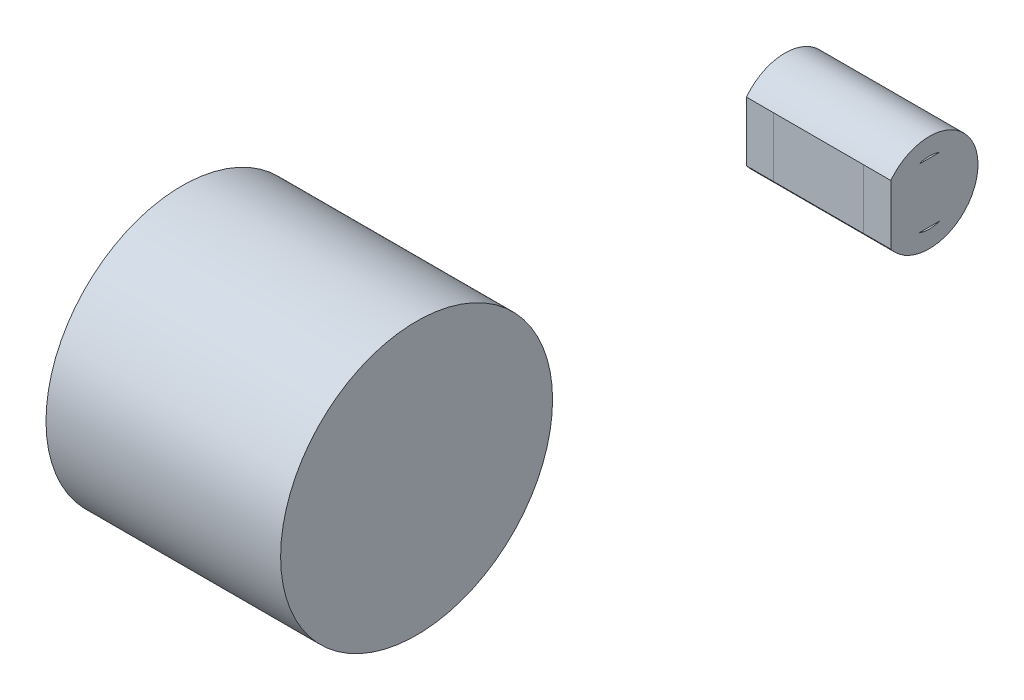
from build123d import *
from build123d.topology import SkipClean

# Parameters (mm, degrees)
SKETCH1_R            = 62.811183182
SKETCH1_R_2          = 3.25
SKETCH1_R_3          = 36.5175
BOSS_EXTRUDE1_DEPTH  = 10
BOSS_EXTRUDE2_START  = -100
SKETCH1_3_R          = 62.811183182
BOSS_EXTRUDE2_DEPTH  = 100
BOSS_EXTRUDE3_DEPTH  = 100
SKETCH2_4_R          = 3.25
SKETCH2_4_R_2        = 36.5175
BOSS_EXTRUDE4_DEPTH  = 10
BOSS_EXTRUDE5_DEPTH  = 100
SKETCH4_R            = 75.344599786
BOSS_EXTRUDE6_DEPTH  = 20
SKETCH5_R            = 7.5
BOSS_EXTRUDE7_DEPTH  = 11
SKETCH5_3_R          = 17.5
SKETCH5_3_R_2        = 7.5
BOSS_EXTRUDE8_DEPTH  = 50
SKETCH6_R            = 7.5
BOSS_EXTRUDE9_DEPTH  = 11
BOSS_EXTRUDE10_DEPTH = 50
BOSS_EXTRUDE11_DEPTH = 15
BOSS_EXTRUDE12_DEPTH = 50
BOSS_EXTRUDE13_DEPTH = 15


# Read off the part's stored shape, not the designer's step: Boss-Extrude11
with BuildPart() as part:
    # Sketch1 → Boss-Extrude1 (new body)
    # profile 1 of 2: a face of its own
    with BuildSketch(Plane(origin=(0, 0, 0), x_dir=(0, 0, -1), z_dir=(1, 0, 0))):
        Circle(SKETCH1_R)
        with BuildLine():
            ThreePointArc((43, 34.9), (40.627564928, 40.627564928), (34.9, 43))
            Line((34.9, 43), (-34.9, 43))
            ThreePointArc((-34.9, 43), (-40.627564928, 40.627564928), (-43, 34.9))
            Line((-43, 34.9), (-43, -34.9))
            ThreePointArc((-43, -34.9), (-40.627564928, -40.627564928), (-34.9, -43))
            Line((-34.9, -43), (34.9, -43))
            ThreePointArc((34.9, -43), (40.627564928, -40.627564928), (43, -34.9))
            Line((43, -34.9), (43, 34.9))
        make_face(mode=Mode.SUBTRACT)
    # profile 2 of 2: a face of its own
    with BuildSketch(Plane(origin=(0, 0, 0), x_dir=(0, 0, -1), z_dir=(1, 0, 0))):
        with BuildLine():
            Line((43, -34.9), (43, 34.9))
            ThreePointArc((43, 34.9), (40.627564928, 40.627564928), (34.9, 43))
            Line((34.9, 43), (-34.9, 43))
            ThreePointArc((-34.9, 43), (-40.627564928, 40.627564928), (-43, 34.9))
            Line((-43, 34.9), (-43, -34.9))
            ThreePointArc((-43, -34.9), (-40.627564928, -40.627564928), (-34.9, -43))
            Line((-34.9, -43), (34.9, -43))
            ThreePointArc((34.9, -43), (40.627564928, -40.627564928), (43, -34.9))
        make_face()
        with Locations((-34.9, -34.9)):
            Circle(SKETCH1_R_2, mode=Mode.SUBTRACT)
        with Locations((34.9, -34.9)):
            Circle(SKETCH1_R_2, mode=Mode.SUBTRACT)
        with Locations((34.9, 34.9)):
            Circle(SKETCH1_R_2, mode=Mode.SUBTRACT)
        with Locations((-34.9, 34.9)):
            Circle(SKETCH1_R_2, mode=Mode.SUBTRACT)
        Circle(SKETCH1_R_3, mode=Mode.SUBTRACT)
    extrude(amount=BOSS_EXTRUDE1_DEPTH)

    # Sketch1<3> → Boss-Extrude2 (add)
    with BuildSketch(Plane(origin=(0, 0, 0), x_dir=(0, 0, -1), z_dir=(1, 0, 0)).offset(BOSS_EXTRUDE2_START)):
        Circle(SKETCH1_3_R)
        with BuildLine():
            ThreePointArc((43, 34.9), (40.627564928, 40.627564928), (34.9, 43))
            Line((34.9, 43), (-34.9, 43))
            ThreePointArc((-34.9, 43), (-40.627564928, 40.627564928), (-43, 34.9))
            Line((-43, 34.9), (-43, -34.9))
            ThreePointArc((-43, -34.9), (-40.627564928, -40.627564928), (-34.9, -43))
            Line((-34.9, -43), (34.9, -43))
            ThreePointArc((34.9, -43), (40.627564928, -40.627564928), (43, -34.9))
            Line((43, -34.9), (43, 34.9))
        make_face(mode=Mode.SUBTRACT)
    extrude(amount=BOSS_EXTRUDE2_DEPTH)


with BuildPart() as body_2:
    # Sketch2 → Boss-Extrude3 (new body)
    with BuildSketch(Plane(origin=(10, 0, 0), x_dir=(0, 0, -1), z_dir=(1, 0, 0))):
        with BuildLine():
            Line((44, 36.5175), (44, -36.5175))
            Line((44, -36.5175), (65.903572821, -36.5175))
            ThreePointArc((65.903572821, -36.5175), (75.344599786, 0), (65.903572821, 36.5175))
            Line((65.903572821, 36.5175), (44, 36.5175))
        make_face()
    extrude(amount=-BOSS_EXTRUDE3_DEPTH)


with BuildPart() as body_3:
    # Sketch2<4> → Boss-Extrude4 (new body)
    # profile 1 of 9: a face of its own
    with BuildSketch(Plane(origin=(10, 0, 0), x_dir=(0, 0, -1), z_dir=(1, 0, 0))):
        with BuildLine():
            Line((44, -36.5175), (44, 36.5175))
            Line((44, 36.5175), (51.104959901, 36.5175))
            ThreePointArc((51.104959901, 36.5175), (-62.811183182, 0), (51.104959901, -36.5175))
            Line((51.104959901, -36.5175), (44, -36.5175))
        make_face()
        with Locations((-34.9, -34.9)):
            Circle(SKETCH2_4_R, mode=Mode.SUBTRACT)
        with Locations((34.9, -34.9)):
            Circle(SKETCH2_4_R, mode=Mode.SUBTRACT)
        Circle(SKETCH2_4_R_2, mode=Mode.SUBTRACT)
        with Locations((-34.9, 34.9)):
            Circle(SKETCH2_4_R, mode=Mode.SUBTRACT)
        with Locations((34.9, 34.9)):
            Circle(SKETCH2_4_R, mode=Mode.SUBTRACT)
    # profile 2 of 9: a face of its own
    with BuildSketch(Plane(origin=(10, 0, 0), x_dir=(0, 0, -1), z_dir=(1, 0, 0))):
        with Locations((34.9, 34.9)):
            Circle(SKETCH2_4_R)
    # profile 3 of 9: a face of its own
    with BuildSketch(Plane(origin=(10, 0, 0), x_dir=(0, 0, -1), z_dir=(1, 0, 0))):
        with Locations((34.9, -34.9)):
            Circle(SKETCH2_4_R)
    # profile 4 of 9: a face of its own
    with BuildSketch(Plane(origin=(10, 0, 0), x_dir=(0, 0, -1), z_dir=(1, 0, 0))):
        with Locations((-34.9, -34.9)):
            Circle(SKETCH2_4_R)
    # profile 5 of 9: a face of its own
    with BuildSketch(Plane(origin=(10, 0, 0), x_dir=(0, 0, -1), z_dir=(1, 0, 0))):
        with Locations((-34.9, 34.9)):
            Circle(SKETCH2_4_R)
    # profile 6 of 9: a face of its own
    with BuildSketch(Plane(origin=(10, 0, 0), x_dir=(0, 0, -1), z_dir=(1, 0, 0))):
        Circle(SKETCH2_4_R_2)
    # profile 7 of 9: a face of its own
    with BuildSketch(Plane(origin=(10, 0, 0), x_dir=(0, 0, -1), z_dir=(1, 0, 0))):
        with BuildLine():
            Line((51.104959901, 36.5175), (44, 36.5175))
            Line((44, 36.5175), (44, -36.5175))
            Line((44, -36.5175), (51.104959901, -36.5175))
            ThreePointArc((51.104959901, -36.5175), (59.813074367, -19.173963269), (62.811183182, 0))
            ThreePointArc((62.811183182, 0), (59.813074367, 19.173963269), (51.104959901, 36.5175))
        make_face()
    # profile 8 of 9: a face of its own
    with BuildSketch(Plane(origin=(10, 0, 0), x_dir=(0, 0, -1), z_dir=(1, 0, 0))):
        with BuildLine():
            Line((65.903572821, 36.5175), (51.104959901, 36.5175))
            ThreePointArc((51.104959901, 36.5175), (59.813074367, 19.173963269), (62.811183182, 0))
            ThreePointArc((62.811183182, 0), (59.813074367, -19.173963269), (51.104959901, -36.5175))
            Line((51.104959901, -36.5175), (65.903572821, -36.5175))
            ThreePointArc((65.903572821, -36.5175), (75.344599786, 0), (65.903572821, 36.5175))
        make_face()
    # profile 9 of 9: a face of its own
    with BuildSketch(Plane(origin=(10, 0, 0), x_dir=(0, 0, -1), z_dir=(1, 0, 0))):
        with BuildLine():
            ThreePointArc((51.104959901, -36.5175), (-62.811183182, 0), (51.104959901, 36.5175))
            Line((51.104959901, 36.5175), (65.903572821, 36.5175))
            ThreePointArc((65.903572821, 36.5175), (-75.344599786, 0), (65.903572821, -36.5175))
            Line((65.903572821, -36.5175), (51.104959901, -36.5175))
        make_face()
    extrude(amount=BOSS_EXTRUDE4_DEPTH)

    # Sketch3 → Boss-Extrude5 (add)
    with BuildSketch(Plane.ZY.offset(-10)):
        with BuildLine():
            ThreePointArc((-65.903572821, -36.5175), (75.344599786, 0), (-65.903572821, 36.5175))
            Line((-65.903572821, 36.5175), (-44, 36.5175))
            Line((-44, 36.5175), (-44, -36.5175))
            Line((-44, -36.5175), (-65.903572821, -36.5175))
        make_face()
    extrude(amount=BOSS_EXTRUDE5_DEPTH)

    # Sketch4 → Boss-Extrude6 (add)
    with SkipClean():  # the faces are left unmerged after this step: merging them gives an invalid solid
        with BuildSketch(Plane.ZY.offset(90)):
            Circle(SKETCH4_R)
        extrude(amount=BOSS_EXTRUDE6_DEPTH)


with BuildPart() as body_4:
    # Sketch5 → Boss-Extrude7 (new body)
    with BuildSketch(Plane(origin=(10, 0, 0), x_dir=(0, 0, -1), z_dir=(1, 0, 0))):
        with Locations((279.100696087, 0)):
            Circle(SKETCH5_R)
    extrude(amount=BOSS_EXTRUDE7_DEPTH)

    # Sketch5<3> → Boss-Extrude8 (add)
    # profile 1 of 2: a face of its own
    with BuildSketch(Plane(origin=(10, 0, 0), x_dir=(0, 0, -1), z_dir=(1, 0, 0))):
        with Locations((279.100696087, 0)):
            Circle(SKETCH5_3_R)
        with Locations((279.100696087, 0)):
            Circle(SKETCH5_3_R_2, mode=Mode.SUBTRACT)
    # profile 2 of 2: a face of its own
    with BuildSketch(Plane(origin=(10, 0, 0), x_dir=(0, 0, -1), z_dir=(1, 0, 0))):
        with Locations((279.100696087, 0)):
            Circle(SKETCH5_3_R_2)
    extrude(amount=-BOSS_EXTRUDE8_DEPTH)

    # Sketch6 → Boss-Extrude9 (add)
    with BuildSketch(Plane.ZY.offset(40)):
        with Locations(Location((-279.100696087, 0, 0), (0, 0, 180))):
            Circle(SKETCH6_R)
    extrude(amount=BOSS_EXTRUDE9_DEPTH)


with BuildPart() as body_5:
    # Sketch7 → Boss-Extrude10 (new body)
    with BuildSketch(Plane(origin=(10, 0, 0), x_dir=(0, 0, -1), z_dir=(1, 0, 0))):
        with BuildLine():
            ThreePointArc((279.100696087, -16.5), (262.600696087, 0), (279.100696087, 16.5))
            Line((279.100696087, 16.5), (257.756246675, 16.5))
            Line((257.756246675, 16.5), (257.756246675, -16.5))
            Line((257.756246675, -16.5), (279.100696087, -16.5))
        make_face()
    extrude(amount=-BOSS_EXTRUDE10_DEPTH)


with BuildPart() as body_6:
    # Boss-Extrude11 outline → Boss-Extrude11 (new body)
    with BuildSketch(Plane(origin=(10, 0, 0), x_dir=(0, 0, -1), z_dir=(1, 0, 0))):
        with BuildLine():
            Line((257.756246675, 16.5), (257.756246675, -16.5))
            ThreePointArc((257.756246675, -16.5), (306.079123037, 0), (257.756246675, 16.5))
        make_face()
        with BuildLine():
            Line((273.269744192, -16.5), (284.931647982, -16.5))
            ThreePointArc((284.931647982, -16.5), (279.100696087, -17.5), (273.269744192, -16.5))
        make_face(mode=Mode.SUBTRACT)
        with BuildLine():
            ThreePointArc((273.269744192, 16.5), (279.100696087, 17.5), (284.931647982, 16.5))
            Line((284.931647982, 16.5), (273.269744192, 16.5))
        make_face(mode=Mode.SUBTRACT)
    extrude(amount=BOSS_EXTRUDE11_DEPTH)

    # Sketch7<4> → Boss-Extrude12 (add)
    with BuildSketch(Plane(origin=(10, 0, 0), x_dir=(0, 0, -1), z_dir=(1, 0, 0))):
        with BuildLine():
            ThreePointArc((273.269744192, 16.5), (279.100696087, 17.5), (284.931647982, 16.5))
            ThreePointArc((284.931647982, 16.5), (293.388657071, 10.104660851), (296.600696087, 0))
            ThreePointArc((296.600696087, 0), (293.388657071, -10.104660851), (284.931647982, -16.5))
            ThreePointArc((284.931647982, -16.5), (279.100696087, -17.5), (273.269744192, -16.5))
            Line((273.269744192, -16.5), (257.756246675, -16.5))
            ThreePointArc((257.756246675, -16.5), (306.079123037, 0), (257.756246675, 16.5))
            Line((257.756246675, 16.5), (273.269744192, 16.5))
        make_face()
    extrude(amount=-BOSS_EXTRUDE12_DEPTH)

    # Sketch8 → Boss-Extrude13 (add)
    with BuildSketch(Plane.ZY.offset(40)):
        with BuildLine():
            Line((-257.756246675, -16.5), (-257.756246675, 16.5))
            ThreePointArc((-257.756246675, 16.5), (-306.079123037, 0), (-257.756246675, -16.5))
        make_face()
    extrude(amount=BOSS_EXTRUDE13_DEPTH)


solid = Compound([part.part, body_2.part, body_3.part, body_4.part, body_5.part, body_6.part])
